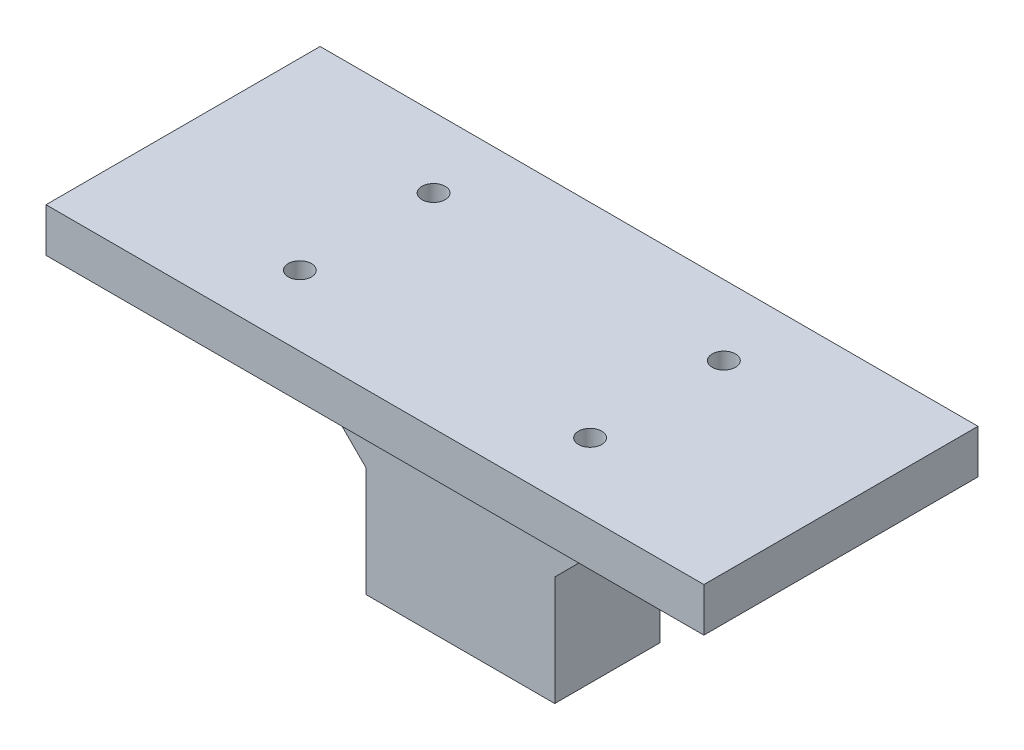
from build123d import *

# Parameters (mm, degrees)
SKETCH1_R           = 2.65
BOSS_EXTRUDE1_DEPTH = 10
SKETCH2_W           = 43
SKETCH2_H           = 24
BOSS_EXTRUDE2_DEPTH = 50
CHAMFER12_SIZE      = 25
SKETCH11_W          = 40.1
SKETCH11_H          = 21
CUT_EXTRUDE3_DEPTH  = 40
BOSS_EXTRUDE3_DEPTH = 43
FILLET1_R           = 10
FILLET5_R           = 1
CUT_EXTRUDE4_DEPTH  = 2


with BuildPart() as part:
    # Sketch1 → Boss-Extrude1 (new body)
    with BuildSketch(Plane(origin=(0, 0, 0), x_dir=(1, 0, 0), z_dir=(0, 1, 0))):
        Polygon((0, 0), (150, 0), (150, 62.5), (99, 62.5), (51, 62.5), (0, 62.5), align=None)
        with Locations(Location((108.05464, 46.5, 0), (0, 0, 270))):
            Circle(SKETCH1_R, mode=Mode.SUBTRACT)
        with Locations(Location((41.87366, 46.5, 0), (0, 0, 270))):
            Circle(SKETCH1_R, mode=Mode.SUBTRACT)
        with Locations(Location((41.87366, 16, 0), (0, 0, 270))):
            Circle(SKETCH1_R, mode=Mode.SUBTRACT)
        with Locations(Location((108.05464, 16, 0), (0, 0, 270))):
            Circle(SKETCH1_R, mode=Mode.SUBTRACT)
    extrude(amount=BOSS_EXTRUDE1_DEPTH)

    # Sketch2 → Boss-Extrude2 (add)
    with BuildSketch(Plane.XZ):
        with Locations((75, -31.5)):
            Rectangle(SKETCH2_W, SKETCH2_H)
    extrude(amount=BOSS_EXTRUDE2_DEPTH)

    # Chamfer12
    chamfer12_edges = [part.edges().sort_by_distance(p)[0] for p in [
        (53.5, 0, -31.5),
        (96.5, 0, -31.5),
    ]]
    chamfer(chamfer12_edges, length=CHAMFER12_SIZE)

    # Sketch11 → Cut-Extrude3 (cut)
    with BuildSketch(Plane.XZ.offset(50)):
        with Locations((75.00366, -31.5)):
            Rectangle(SKETCH11_W, SKETCH11_H)
    extrude(amount=-CUT_EXTRUDE3_DEPTH, mode=Mode.SUBTRACT)

    # Sketch12 → Boss-Extrude3 (add)
    with BuildSketch(Plane.ZY.offset(-53.5)):
        Polygon((-43.5, -25), (-43.5, 0), (-62.5, 0), align=None)
    extrude(amount=-BOSS_EXTRUDE3_DEPTH)

    # Fillet1
    fillet1_edges = [part.edges().sort_by_distance(p)[0] for p in [
        (28.5, 0, -31.5),
        (121.5, 0, -31.5),
    ]]
    fillet(fillet1_edges, radius=FILLET1_R)

    # Fillet5
    # the kernel refuses this fillet: 1 mm, written as the material it adds along each edge
    with BuildSketch(Plane(origin=(96.5, 0, -41), x_dir=(1, 0, 0), z_dir=(0, 0, -1))) as fillet5_piece_1_section:
        with BuildLine():
            CenterArc((FILLET5_R, FILLET5_R), FILLET5_R, 180, 90)
            Line((0, FILLET5_R), (0, 0))
            Line((0, 0), (FILLET5_R, 0))
        make_face()
    fillet5_piece_1 = extrude(amount=21.5, mode=Mode.PRIVATE)
    fillet5_piece_1 = split(fillet5_piece_1, bisect_by=Plane(origin=(96.726395114, -9.898830574, -54.976888763), z_dir=(0, 0.6050832675335575, 0.7961621941231029)), keep=Keep.TOP, mode=Mode.PRIVATE)
    add(fillet5_piece_1)
    with BuildSketch(Plane(origin=(96.5, -27.5, -43.5), x_dir=(1, 0, 0), z_dir=(0, 1, 0))) as fillet5_piece_2_section:
        with BuildLine():
            CenterArc((FILLET5_R, FILLET5_R), FILLET5_R, 180, 90)
            Line((0, FILLET5_R), (0, 0))
            Line((0, 0), (FILLET5_R, 0))
        make_face()
    fillet5_piece_2 = extrude(amount=30, mode=Mode.PRIVATE)
    fillet5_piece_2 = split(fillet5_piece_2, bisect_by=Plane(origin=(102.972342409, -18.527657591, -43.72500317), z_dir=(-0.7071067811865476, 0.7071067811865476, 0)), keep=Keep.TOP, mode=Mode.PRIVATE)
    fillet5_piece_2 = split(fillet5_piece_2, bisect_by=Plane(origin=(96.726036712, -16.829582585, -49.709517236), z_dir=(0, 0.6050832675335575, 0.7961621941231029)), keep=Keep.TOP, mode=Mode.PRIVATE)
    add(fillet5_piece_2)
    with BuildSketch(Plane(origin=(53.5, 0, -41), x_dir=(-1, 0, 0), z_dir=(0, 0, -1))) as fillet5_piece_3_section:
        with BuildLine():
            CenterArc((FILLET5_R, -FILLET5_R), FILLET5_R, 90, 90)
            Line((0, -FILLET5_R), (0, 0))
            Line((0, 0), (FILLET5_R, 0))
        make_face()
    fillet5_piece_3 = extrude(amount=21.5, mode=Mode.PRIVATE)
    fillet5_piece_3 = split(fillet5_piece_3, bisect_by=Plane(origin=(53.273604886, -9.898830574, -54.976888763), z_dir=(0, 0.6050832675335575, 0.7961621941231029)), keep=Keep.TOP, mode=Mode.PRIVATE)
    add(fillet5_piece_3)
    with BuildSketch(Plane(origin=(53.5, -27.5, -43.5), x_dir=(0, 0, -1), z_dir=(0, 1, 0))) as fillet5_piece_4_section:
        with BuildLine():
            CenterArc((FILLET5_R, FILLET5_R), FILLET5_R, 180, 90)
            Line((0, FILLET5_R), (0, 0))
            Line((0, 0), (FILLET5_R, 0))
        make_face()
    fillet5_piece_4 = extrude(amount=30, mode=Mode.PRIVATE)
    fillet5_piece_4 = split(fillet5_piece_4, bisect_by=Plane(origin=(47.02765759, -18.52765759, -43.72500317), z_dir=(0.7071067811865476, 0.7071067811865476, 0)), keep=Keep.TOP, mode=Mode.PRIVATE)
    fillet5_piece_4 = split(fillet5_piece_4, bisect_by=Plane(origin=(53.273963288, -16.829582583, -49.709517237), z_dir=(0, 0.6050832675335575, 0.7961621941231029)), keep=Keep.TOP, mode=Mode.PRIVATE)
    add(fillet5_piece_4)

    # Sketch14 → Cut-Extrude4 (cut)
    with BuildSketch(Plane(origin=(0, 0, -43.5), x_dir=(-1, 0, 0), z_dir=(0, 0, -1))):
        with BuildLine():
            Line((-24.357864376, 0), (-52.5, 0))
            Line((-52.5, 0), (-52.5, -24))
            Line((-52.5, -24), (-31.428932188, -2.928932188))
            ThreePointArc((-31.428932188, -2.928932188), (-28.1846987, -0.761204675), (-24.357864376, 0))
        make_face()
        with BuildLine():
            Line((-97.5, -24), (-97.5, 0))
            Line((-97.5, 0), (-125.642135624, 0))
            ThreePointArc((-125.642135624, 0), (-121.8153013, -0.761204675), (-118.571067812, -2.928932188))
            Line((-118.571067812, -2.928932188), (-97.5, -24))
        make_face()
    extrude(amount=-CUT_EXTRUDE4_DEPTH, mode=Mode.SUBTRACT)


solid = part.part
